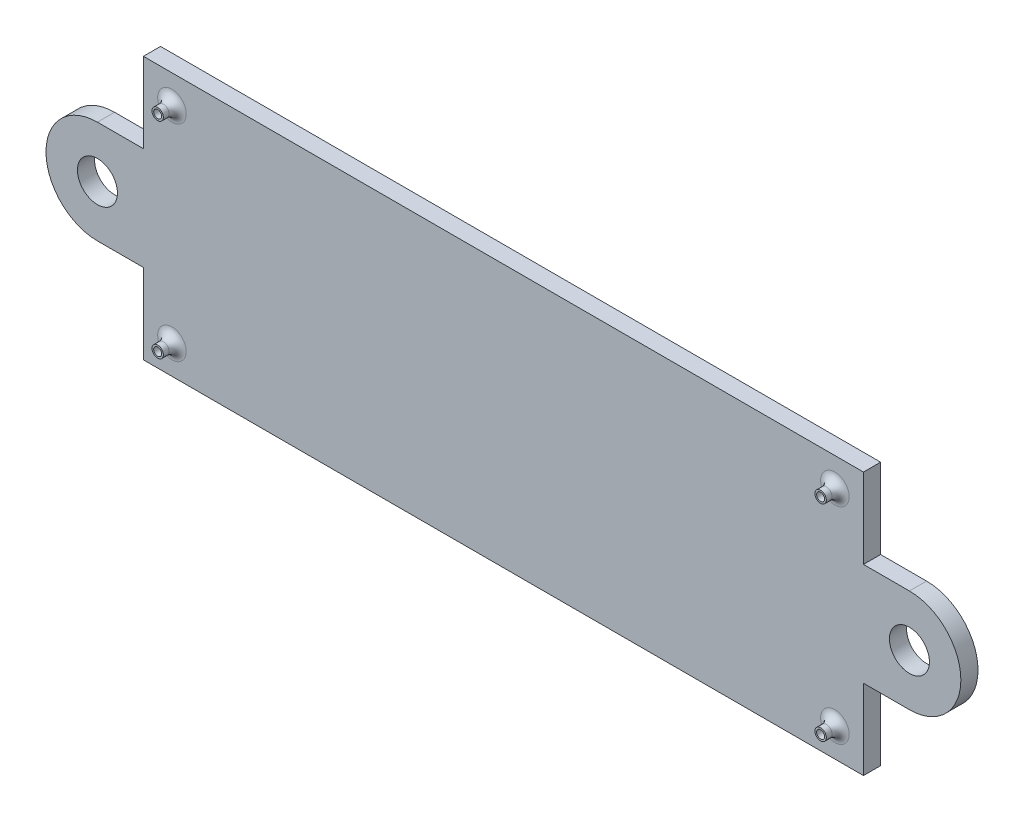
from build123d import *

# Parameters (mm, degrees)
SKETCH_1_W             = 123
SKETCH_1_H             = 43
EXTRUDE_1_DEPTH        = 3
SKETCH_2_W             = 126
SKETCH_2_H             = 46
SKETCH_2_W_2           = 123
SKETCH_2_H_2           = 43
EXTRUDE_2_DEPTH        = 3
SKETCH_5_R             = 1
SKETCH_5_R_2           = 0.697721568
EXTRUDE_5_DEPTH        = 2.5
FILLET_6_R             = 1.5
FILLET_6_OF_MIRROR_1_R = 1.5
SKETCH_8_R             = 3.5
EXTRUDE_8_DEPTH        = 3


# Read off the part's stored shape, not the designer's step: Зеркальное отражение2
with BuildPart() as part:
    # Эскиз1 → Бобышка-Вытянуть1 (new body)
    with BuildSketch(Plane.XY):
        with Locations((61.5, 21.5)):
            Rectangle(SKETCH_1_W, SKETCH_1_H)
    extrude(amount=EXTRUDE_1_DEPTH)

    # Эскиз2 → Бобышка-Вытянуть2 (add)
    with BuildSketch(Plane.XY.offset(3)):
        with Locations((61.5, 21.5)):
            Rectangle(SKETCH_2_W, SKETCH_2_H)
        with Locations((61.5, 21.5)):
            Rectangle(SKETCH_2_W_2, SKETCH_2_H_2, mode=Mode.SUBTRACT)
    extrude(amount=-EXTRUDE_2_DEPTH)

    # Эскиз5 → Бобышка-Вытянуть5 (add)
    with BuildSketch(Plane.XY.offset(3)):
        with Locations(Location((3.5, 39.5, 0), (0, 0, 180))):
            Circle(SKETCH_5_R)
        with Locations((3.5, 39.5)):
            Circle(SKETCH_5_R_2, mode=Mode.SUBTRACT)
    extrude_5 = extrude(amount=EXTRUDE_5_DEPTH)

    # Скругление6
    fillet_6_edges = [part.edges().sort_by_distance(p)[0] for p in [
        (4.5, 39.5, 3),
    ]]
    fillet(fillet_6_edges, radius=FILLET_6_R)

    # Зеркальное отражение1: Бобышка-Вытянуть5 across plane
    add(extrude_5.mirror(Plane.ZY.offset(-61.5)))

    # Скругление6 of Зеркальное отражение1
    fillet_6_of_mirror_1_edges = [part.edges().sort_by_distance(p)[0] for p in [
        (118.5, 39.5, 3),
    ]]
    fillet(fillet_6_of_mirror_1_edges, radius=FILLET_6_OF_MIRROR_1_R)

    # Зеркальное отражение2 outline → Зеркальное отражение2 (revolve)
    with BuildSketch(Plane(origin=(3.5, 3.5, 0), x_dir=(1, 0, 0), z_dir=(0, -1, 0))):
        with BuildLine():
            Line((1, 5.5), (0.697721568, 5.5))
            Line((0.697721568, 5.5), (0.697721568, 3))
            Line((0.697721568, 3), (2.5, 3))
            ThreePointArc((2.5, 3), (1.439339828, 3.439339828), (1, 4.5))
            Line((1, 4.5), (1, 5.5))
        make_face()
    revolve(axis=Axis((3.5, 3.5, 0), (0, 0, 1)))

    # Mirror 2 2 outline → Mirror 2 2 (revolve)
    with BuildSketch(Plane(origin=(119.5, 3.5, 0), x_dir=(1, 0, 0), z_dir=(0, -1, 0))):
        with BuildLine():
            Line((1, 5.5), (0.697721568, 5.5))
            Line((0.697721568, 5.5), (0.697721568, 3))
            Line((0.697721568, 3), (2.5, 3))
            ThreePointArc((2.5, 3), (1.439339828, 3.439339828), (1, 4.5))
            Line((1, 4.5), (1, 5.5))
        make_face()
    revolve(axis=Axis((119.5, 3.5, 0), (0, 0, 1)))

    # Эскиз8 → Бобышка-Вытянуть8 (add)
    with BuildSketch(Plane(origin=(0, 0, 0), x_dir=(-1, 0, 0), z_dir=(0, 0, -1))):
        with BuildLine():
            Line((-124.5, 12.5), (-132.54002612, 12.5))
            ThreePointArc((-132.54002612, 12.5), (-141.54002612, 21.5), (-132.54002612, 30.5))
            Line((-132.54002612, 30.5), (-124.5, 30.5))
            Line((-124.5, 30.5), (-124.5, 12.5))
        make_face()
        with Locations((-132.54002612, 21.5)):
            Circle(SKETCH_8_R, mode=Mode.SUBTRACT)
    extrude_8 = extrude(amount=-EXTRUDE_8_DEPTH)

    # Зеркальное отражение8: Бобышка-Вытянуть8 across plane
    add(extrude_8.mirror(Plane.ZY.offset(-61.5)))


solid = part.part
